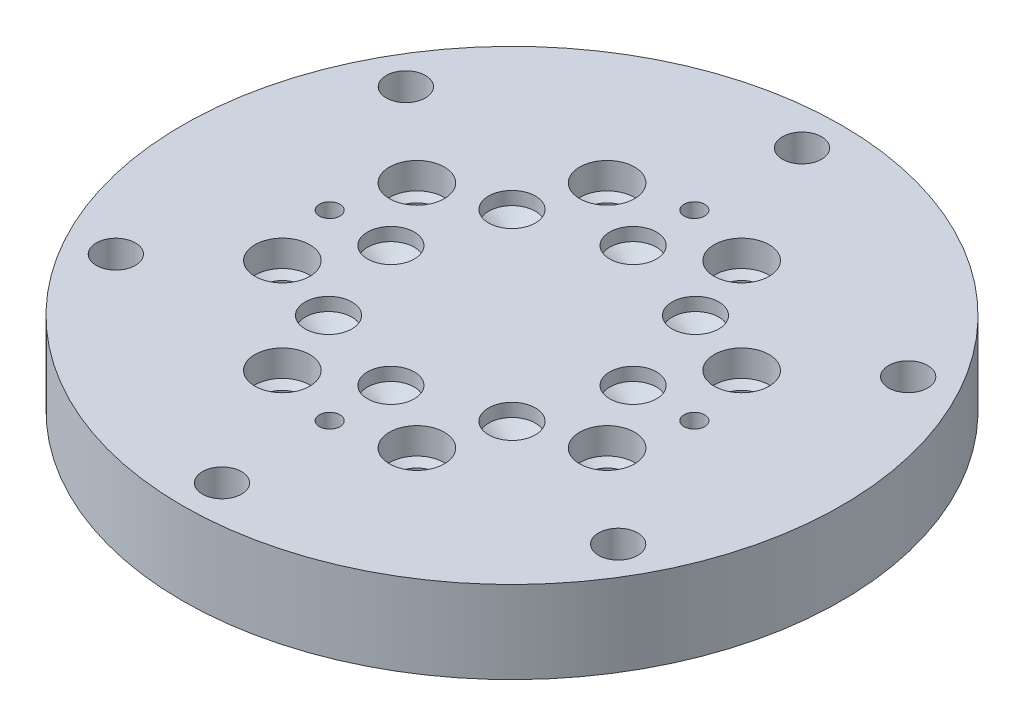
from build123d import *

# Parameters (mm, degrees)
OUTER_R                               = 19.05
BODY_DEPTH                            = 4.7625
F_4_40_TAPPED_HOLE_D                  = 2.2606
SCREW_HOLES_COUNT                     = 6
F_0_80_TAPPED_HOLE_D                  = 1.19126
INNER_SCREW_HOLES_COUNT               = 4
F_43_0_089_DIAMETER_HOLE1_D           = 2.2606
IO_HOLES_PATTERN_COUNT                = 8
F_36_0_1065_DIAMETER_HOLE1_AT_2_COUNT = 2
F_36_0_1065_DIAMETER_HOLE1_AT_2_PITCH = 5.568104507
POST_BOTTOMS_COUNT                    = 4


with BuildPart() as part:
    # outer → Body (new body)
    with BuildSketch(Plane(origin=(0, 0, 0), x_dir=(1, 0, 0), z_dir=(0, 1, 0))):
        Circle(OUTER_R)
    extrude(amount=-BODY_DEPTH)

    # #4-40 Tapped Hole (through all)
    with Locations(Plane(origin=(0, 0, 0), x_dir=(1, 0, 0), z_dir=(0, 1, 0))):
        with Locations((0, -16.764)):
            f_4_40_tapped_hole = Hole(F_4_40_TAPPED_HOLE_D / 2)

    # Screw Holes: #4-40 Tapped Hole ×6 about axis
    screw_holes_axis = Axis((0, 0.15875, 0), (0, -1, 0))
    for i in range(1, SCREW_HOLES_COUNT):
        add(f_4_40_tapped_hole.rotate(screw_holes_axis, i * 360 / SCREW_HOLES_COUNT), mode=Mode.SUBTRACT)

    # #0-80 Tapped Hole (through all)
    with Locations(Plane(origin=(0, 0, 0), x_dir=(1, 0, 0), z_dir=(0, 1, 0))):
        with Locations((0, 10.541)):
            f_0_80_tapped_hole = Hole(F_0_80_TAPPED_HOLE_D / 2)

    # Inner Screw Holes: #0-80 Tapped Hole ×4 about axis
    inner_screw_holes_axis = Axis((0, 0.15875, 0), (0, -1, 0))
    for i in range(1, INNER_SCREW_HOLES_COUNT):
        add(f_0_80_tapped_hole.rotate(inner_screw_holes_axis, i * 360 / INNER_SCREW_HOLES_COUNT), mode=Mode.SUBTRACT)

    # #43 (0.089) Diameter Hole1 (through all)
    with Locations(Plane(origin=(0, 0, 0), x_dir=(1, 0, 0), z_dir=(0, 1, 0))):
        with Locations((-3.888063673, 9.38661605)):
            f_43_0_089_diameter_hole1 = Hole(F_43_0_089_DIAMETER_HOLE1_D / 2)

    # Sketch40 → 1/8 (0.125) Diameter Hole1 (revolve, cut)
    with BuildSketch(Plane(origin=(-3.888063673, 0, -9.38661605), x_dir=(0, 0, 1), z_dir=(1, 0, 0))):
        Polygon((0, 0), (0, 2.477866233), (1.5875, 1.524), (1.5875, 0), align=None)
    f_1_8_0_125_diameter_hole1 = revolve(axis=Axis((-3.888063673, 6.35, -9.38661605), (0, -1, 0)), mode=Mode.SUBTRACT)

    # Sketch42 → 1/8 (0.125) Diameter Hole2 (revolve, cut)
    with BuildSketch(Plane(origin=(-3.888063673, -4.7625, -9.38661605), x_dir=(0, 0, -1), z_dir=(1, 0, 0))):
        Polygon((0, 0), (0, 2.477866233), (1.5875, 1.524), (1.5875, 0), align=None)
    f_1_8_0_125_diameter_hole2 = revolve(axis=Axis((-3.888063673, -11.1125, -9.38661605), (0, 1, 0)), mode=Mode.SUBTRACT)

    # IO Holes Pattern: #43 (0.089) Diameter Hole1, 1/8 (0.125) Diameter Hole1, 1/8 (0.125) Diameter Hole2 ×8 about axis
    io_holes_pattern_axis = Axis((0, 0.15875, 0), (0, -1, 0))
    add([f_43_0_089_diameter_hole1.rotate(io_holes_pattern_axis, i * 360 / IO_HOLES_PATTERN_COUNT) for i in range(1, IO_HOLES_PATTERN_COUNT)], mode=Mode.SUBTRACT)
    add([f_1_8_0_125_diameter_hole1.rotate(io_holes_pattern_axis, i * 360 / IO_HOLES_PATTERN_COUNT) for i in range(1, IO_HOLES_PATTERN_COUNT)], mode=Mode.SUBTRACT)
    add([f_1_8_0_125_diameter_hole2.rotate(io_holes_pattern_axis, i * 360 / IO_HOLES_PATTERN_COUNT) for i in range(1, IO_HOLES_PATTERN_COUNT)], mode=Mode.SUBTRACT)

    # Sketch45 → #36 (0.1065) Diameter Hole1 (revolve, cut)
    with BuildSketch(Plane(origin=(0, 0, -6.99999997), x_dir=(0, 0, 1), z_dir=(1, 0, 0))):
        Polygon((0, 0), (0, 1.57469403), (1.35255, 0.762), (1.35255, 0), align=None)
    f_36_0_1065_diameter_hole1 = revolve(axis=Axis((0, 6.35, -6.99999997), (0, -1, 0)), mode=Mode.SUBTRACT)

    # #36 (0.1065) Diameter Hole1 at 2: #36 (0.1065) Diameter Hole1 ×2
    with Locations(*[Vector(-0.9524427643588189, 0, 0.30471754235772414) * (i * F_36_0_1065_DIAMETER_HOLE1_AT_2_PITCH) for i in range(1, F_36_0_1065_DIAMETER_HOLE1_AT_2_COUNT)]):
        add(f_36_0_1065_diameter_hole1, mode=Mode.SUBTRACT)

    # Post Bottoms: #36 (0.1065) Diameter Hole1 ×4 about axis
    post_bottoms_axis = Axis((0, 0.15875, 0), (0, -1, 0))
    for i in range(1, POST_BOTTOMS_COUNT):
        add(f_36_0_1065_diameter_hole1.rotate(post_bottoms_axis, i * 360 / POST_BOTTOMS_COUNT), mode=Mode.SUBTRACT)

    # Post Bottoms copy 1 sketch → Post Bottoms copy 1 (revolve, cut)
    with BuildSketch(Plane(origin=(5.303300849, 0, -5.303300849), x_dir=(-1, 0, 0), z_dir=(0, 0, 1))):
        Polygon((0, 0), (0, 1.57469403), (1.35255, 0.762), (1.35255, 0), align=None)
    revolve(axis=Axis((5.303300849, 6.35, -5.303300849), (0, -1, 0)), mode=Mode.SUBTRACT)

    # Post Bottoms copy 2 sketch → Post Bottoms copy 2 (revolve, cut)
    with BuildSketch(Plane(origin=(5.303300849, 0, 5.303300849), x_dir=(0, 0, -1), z_dir=(-1, 0, 0))):
        Polygon((0, 0), (0, 1.57469403), (1.35255, 0.762), (1.35255, 0), align=None)
    revolve(axis=Axis((5.303300849, 6.35, 5.303300849), (0, -1, 0)), mode=Mode.SUBTRACT)

    # Post Bottoms copy 3 sketch → Post Bottoms copy 3 (revolve, cut)
    with BuildSketch(Plane(origin=(-5.303300849, 0, 5.303300849), x_dir=(1, 0, 0), z_dir=(0, 0, -1))):
        Polygon((0, 0), (0, 1.57469403), (1.35255, 0.762), (1.35255, 0), align=None)
    revolve(axis=Axis((-5.303300849, 6.35, 5.303300849), (0, -1, 0)), mode=Mode.SUBTRACT)


solid = part.part
